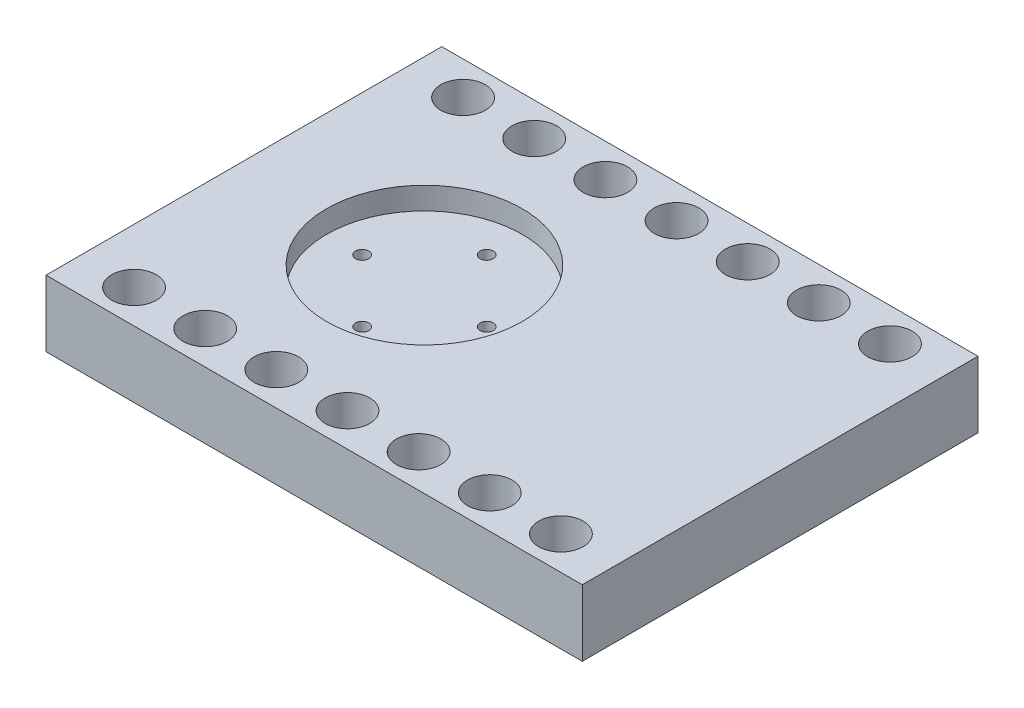
from build123d import *

# Parameters (mm, degrees)
SKETCH3_W           = 60.3
SKETCH3_H           = 44.5
SKETCH3_R           = 0.75
BOSS_EXTRUDE1_DEPTH = 7.46
SKETCH4_R           = 11
CUT_EXTRUDE1_DEPTH  = 2.5
SKETCH5_R           = 2.5
CUT_EXTRUDE2_DEPTH  = 39.206499447


with BuildPart() as part:
    # Sketch3 → Boss-Extrude1 (new body)
    with BuildSketch(Plane(origin=(0, 0, 0), x_dir=(1, 0, 0), z_dir=(0, 1, 0))):
        Rectangle(SKETCH3_W, SKETCH3_H)
        with Locations((-9.85, 7)):
            Circle(SKETCH3_R, mode=Mode.SUBTRACT)
        with Locations((-16.85, 0)):
            Circle(SKETCH3_R, mode=Mode.SUBTRACT)
        with Locations((-9.85, -7)):
            Circle(SKETCH3_R, mode=Mode.SUBTRACT)
        with Locations((-2.85, 0)):
            Circle(SKETCH3_R, mode=Mode.SUBTRACT)
    extrude(amount=BOSS_EXTRUDE1_DEPTH)

    # Sketch4 → Cut-Extrude1 (cut)
    with BuildSketch(Plane(origin=(0, 7.46, 0), x_dir=(1, 0, 0), z_dir=(0, 1, 0))):
        with Locations((-9.85, 0)):
            Circle(SKETCH4_R)
    extrude(amount=-CUT_EXTRUDE1_DEPTH, mode=Mode.SUBTRACT)

    # Sketch5 → Cut-Extrude2 (cut, through all)
    with BuildSketch(Plane(origin=(0, 7.46, 0), x_dir=(1, 0, 0), z_dir=(0, 1, 0))):
        with Locations((0, 18.5)):
            Circle(SKETCH5_R)
        with Locations((8, 18.5)):
            Circle(SKETCH5_R)
        with Locations((16, 18.5)):
            Circle(SKETCH5_R)
        with Locations((24, 18.5)):
            Circle(SKETCH5_R)
        with Locations((-24, 18.5)):
            Circle(SKETCH5_R)
        with Locations((-16, 18.5)):
            Circle(SKETCH5_R)
        with Locations((-8, 18.5)):
            Circle(SKETCH5_R)
        with Locations((-8, -18.5)):
            Circle(SKETCH5_R)
        with Locations((-16, -18.5)):
            Circle(SKETCH5_R)
        with Locations((-24, -18.5)):
            Circle(SKETCH5_R)
        with Locations((24, -18.5)):
            Circle(SKETCH5_R)
        with Locations((16, -18.5)):
            Circle(SKETCH5_R)
        with Locations((8, -18.5)):
            Circle(SKETCH5_R)
        with Locations((0, -18.5)):
            Circle(SKETCH5_R)
    extrude(amount=-CUT_EXTRUDE2_DEPTH, mode=Mode.SUBTRACT)


solid = part.part
